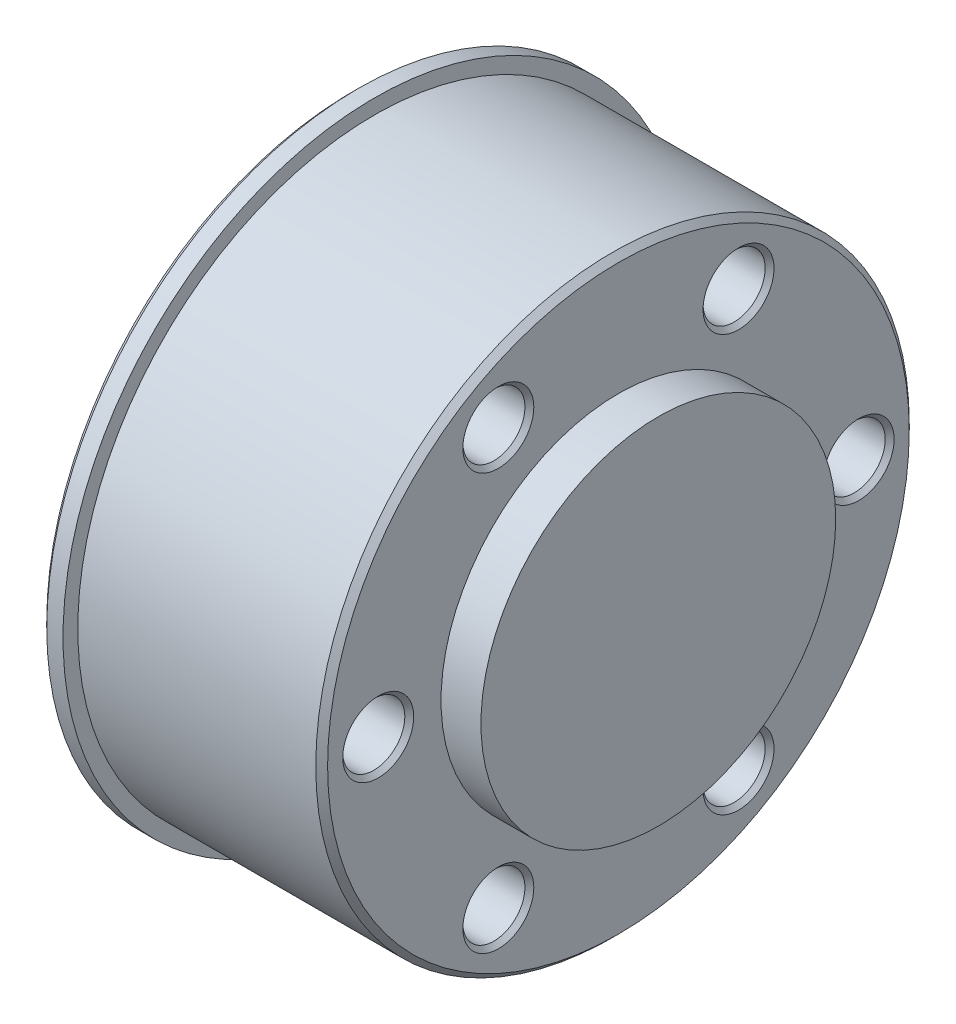
from build123d import *

# Parameters (mm, degrees)
SKETCH3_R          = 1.625
CUT_EXTRUDE1_DEPTH = 12
SKETCH4_R          = 2.1
CUT_EXTRUDE2_DEPTH = 10
CHAMFER1_SIZE      = 0.4
CHAMFER2_SIZE      = 0.4
CHAMFER3_SIZE      = 0.4
CHAMFER4_SIZE      = 0.3
CHAMFER5_SIZE      = 0.4


with BuildPart() as part:
    # Sketch2 → Revolve1 (revolve)
    with BuildSketch(Plane(origin=(0, 0, 0), x_dir=(1, 0, 0), z_dir=(0, 1, 0))):
        Polygon((0, 0), (0, 12), (-2.7, 12), (-2.7, 20.075), (-19.2, 20.075), (-19.2, 21.075), (-20.7, 21.075), (-20.7, 17.727837292), (-20.7, 14.575), (-20.7, 8.1), (-15.7, 8.1), (-15.7, 6), (-13.7, 6), (-13.7, 0), align=None)
    revolve(axis=Axis((0, 0, 0), (-1, 0, 0)))

    # Sketch3 → Cut-Extrude1 (cut)
    with BuildSketch(Plane.ZY.offset(20.7)):
        with Locations((0, 16)):
            Circle(SKETCH3_R)
        with Locations((13.856406461, 7.904729806)):
            Circle(SKETCH3_R)
        with Locations((13.773900052, -8.142905292)):
            Circle(SKETCH3_R)
        with Locations((-0.165012817, -16.095270194)):
            Circle(SKETCH3_R)
        with Locations((-14.021419278, -8)):
            Circle(SKETCH3_R)
        with Locations((-13.938912869, 8.047635097)):
            Circle(SKETCH3_R)
    extrude(amount=-CUT_EXTRUDE1_DEPTH, mode=Mode.SUBTRACT)

    # Sketch4 → Cut-Extrude2 (cut)
    with BuildSketch(Plane(origin=(-2.7, 0, 0), x_dir=(0, 0, -1), z_dir=(1, 0, 0))):
        with Locations((-8.125, 14.072912811)):
            Circle(SKETCH4_R)
        with Locations((8.125, 14.072912811)):
            Circle(SKETCH4_R)
        with Locations((16.25, 0)):
            Circle(SKETCH4_R)
        with Locations((8.125, -14.072912811)):
            Circle(SKETCH4_R)
        with Locations((-8.125, -14.072912811)):
            Circle(SKETCH4_R)
        with Locations((-16.25, 0)):
            Circle(SKETCH4_R)
    extrude(amount=-CUT_EXTRUDE2_DEPTH, mode=Mode.SUBTRACT)

    # Chamfer1
    chamfer1_edges = [part.edges().sort_by_distance(p)[0] for p in [
        (-2.7, 0, 20.075),
    ]]
    chamfer(chamfer1_edges, length=CHAMFER1_SIZE)

    # Chamfer2
    chamfer2_edges = [part.edges().sort_by_distance(p)[0] for p in [
        (-20.7, 0, 8.1),
    ]]
    chamfer(chamfer2_edges, length=CHAMFER2_SIZE)

    # Chamfer3
    chamfer3_edges = [part.edges().sort_by_distance(p)[0] for p in [
        (-20.7, -16.095270194, -1.790012817),
        (-20.7, -8, -15.646419278),
        (-20.7, 8.047635097, -15.563912869),
        (-20.7, -8.142905292, 12.148900052),
        (-20.7, 7.904729806, 12.231406461),
        (-20.7, 16, -1.625),
    ]]
    chamfer(chamfer3_edges, length=CHAMFER3_SIZE)

    # Chamfer4
    chamfer4_edges = [part.edges().sort_by_distance(p)[0] for p in [
        (-2.7, -14.072912811, -6.025),
        (-2.7, 0, -14.15),
        (-2.7, 14.072912811, -6.025),
        (-2.7, 14.072912811, 10.225),
        (-2.7, -14.072912811, 10.225),
        (-2.7, 0, 18.35),
    ]]
    chamfer(chamfer4_edges, length=CHAMFER4_SIZE)

    # Chamfer5
    chamfer5_edges = [part.edges().sort_by_distance(p)[0] for p in [
        (-20.7, 0, 21.075),
    ]]
    chamfer(chamfer5_edges, length=CHAMFER5_SIZE)


solid = part.part
